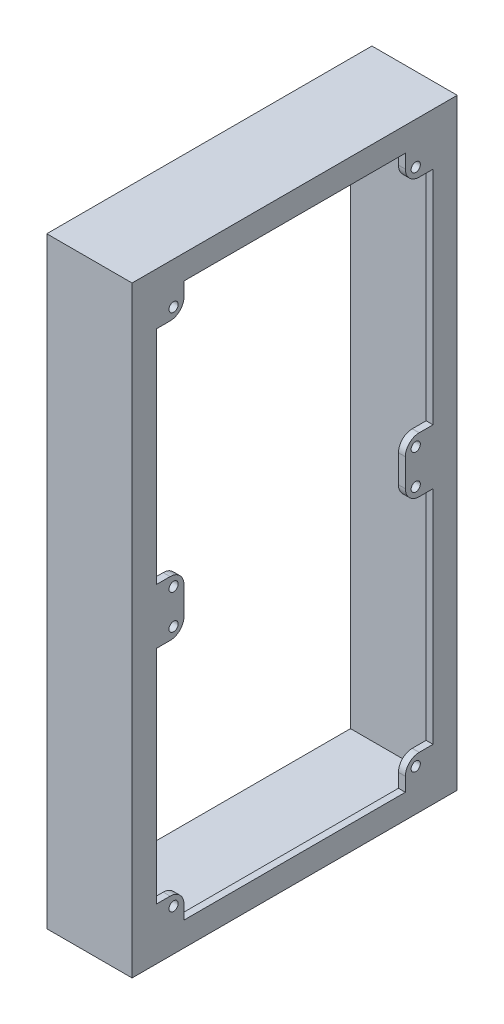
from build123d import *

# Parameters (mm, degrees)
SKETCH1_W                = 261
SKETCH1_H                = 141
SKETCH1_W_2              = 240
SKETCH1_H_2              = 120
SKETCH1_R                = 2
BOSS_EXTRUDE2_DEPTH      = 3
SKETCH1_6_W              = 261
SKETCH1_6_H              = 141
SKETCH1_6_W_2            = 240
SKETCH1_6_H_2            = 120
BOSS_EXTRUDE5_DEPTH      = 34
SKETCH14_W               = 259
SKETCH14_H               = 139
SKETCH14_W_2             = 258.2
SKETCH14_H_2             = 138.2
BOSS_EXTRUDE7_DEPTH      = 0.2
SKETCH17_W               = 259.4
SKETCH17_H               = 139.4
SKETCH17_W_2             = 258.2
SKETCH17_H_2             = 138.2
BOSS_EXTRUDE10_DEPTH     = 0.4
CHAMFER1_SIZE            = 0.4
CHAMFER1_SIZE_2          = 0.230940108
COVER_START              = -0.4
SKETCH18_R               = 3.15
COVER_MAGNET_HOLES_DEPTH = 2.2
SKETCH19_W               = 16
SKETCH19_H               = 240
CUT_EXTRUDE1_DEPTH       = 5
CHAMFER2_SIZE            = 3
CHAMFER2_SIZE_2          = 5.196152423
CHAMFER3_SIZE            = 5
CUT_EXTRUDE2_START       = -10.5
CUT_EXTRUDE2_DEPTH       = 11.5
CUT_EXTRUDE3_REACH       = 154.871
SKETCH21_W               = 242.4
SKETCH21_H               = 122.4


with BuildPart() as part:
    # Sketch1 → Boss-Extrude2 (new body)
    # profile 1 of 9: a face of its own
    with BuildSketch(Plane.YZ):
        Rectangle(SKETCH1_W, SKETCH1_H)
        Rectangle(SKETCH1_W_2, SKETCH1_H_2, mode=Mode.SUBTRACT)
    # profile 2 of 9: a face of its own
    with BuildSketch(Plane.YZ):
        with BuildLine():
            Line((-120, 60), (-120, 48))
            Line((-120, 48), (-114, 48))
            ThreePointArc((-114, 48), (-109.757359313, 49.757359313), (-108, 54))
            Line((-108, 54), (-108, 60))
            Line((-108, 60), (-120, 60))
        make_face()
        with Locations(Location((-112.5, 52.5, 0), (0, 0, 270))):
            Circle(SKETCH1_R, mode=Mode.SUBTRACT)
    # profile 3 of 9: a face of its own
    with BuildSketch(Plane.YZ):
        with BuildLine():
            Line((0, 60), (-12, 60))
            Line((-12, 60), (-12, 54))
            ThreePointArc((-12, 54), (-10.242640687, 49.757359313), (-6, 48))
            Line((-6, 48), (0, 48))
            Line((0, 48), (0, 60))
        make_face()
        with Locations(Location((-7.5, 52.5, 0), (0, 0, 270))):
            Circle(SKETCH1_R, mode=Mode.SUBTRACT)
    # profile 4 of 9: a face of its own
    with BuildSketch(Plane.YZ):
        with BuildLine():
            Line((12, 60), (0, 60))
            Line((0, 60), (0, 48))
            Line((0, 48), (6, 48))
            ThreePointArc((6, 48), (10.242640687, 49.757359313), (12, 54))
            Line((12, 54), (12, 60))
        make_face()
        with Locations(Location((7.5, 52.5, 0), (0, 0, 270))):
            Circle(SKETCH1_R, mode=Mode.SUBTRACT)
    # profile 5 of 9: a face of its own
    with BuildSketch(Plane.YZ):
        with BuildLine():
            Line((114, 48), (120, 48))
            Line((120, 48), (120, 60))
            Line((120, 60), (108, 60))
            Line((108, 60), (108, 54))
            ThreePointArc((108, 54), (109.757359313, 49.757359313), (114, 48))
        make_face()
        with Locations(Location((112.5, 52.5, 0), (0, 0, 270))):
            Circle(SKETCH1_R, mode=Mode.SUBTRACT)
    # profile 6 of 9: a face of its own
    with BuildSketch(Plane.YZ):
        with BuildLine():
            Line((108, -54), (108, -60))
            Line((108, -60), (120, -60))
            Line((120, -60), (120, -48))
            Line((120, -48), (114, -48))
            ThreePointArc((114, -48), (109.757359313, -49.757359313), (108, -54))
        make_face()
        with Locations(Location((112.5, -52.5, 0), (0, 0, 270))):
            Circle(SKETCH1_R, mode=Mode.SUBTRACT)
    # profile 7 of 9: a face of its own
    with BuildSketch(Plane.YZ):
        with BuildLine():
            Line((0, -48), (0, -60))
            Line((0, -60), (12, -60))
            Line((12, -60), (12, -54))
            ThreePointArc((12, -54), (10.242640687, -49.757359313), (6, -48))
            Line((6, -48), (0, -48))
        make_face()
        with Locations(Location((7.5, -52.5, 0), (0, 0, 270))):
            Circle(SKETCH1_R, mode=Mode.SUBTRACT)
    # profile 8 of 9: a face of its own
    with BuildSketch(Plane.YZ):
        with BuildLine():
            Line((-12, -54), (-12, -60))
            Line((-12, -60), (0, -60))
            Line((0, -60), (0, -48))
            Line((0, -48), (-6, -48))
            ThreePointArc((-6, -48), (-10.242640687, -49.757359313), (-12, -54))
        make_face()
        with Locations(Location((-7.5, -52.5, 0), (0, 0, 270))):
            Circle(SKETCH1_R, mode=Mode.SUBTRACT)
    # profile 9 of 9: a face of its own
    with BuildSketch(Plane.YZ):
        with BuildLine():
            Line((-120, -48), (-120, -60))
            Line((-120, -60), (-108, -60))
            Line((-108, -60), (-108, -54))
            ThreePointArc((-108, -54), (-109.757359313, -49.757359313), (-114, -48))
            Line((-114, -48), (-120, -48))
        make_face()
        with Locations(Location((-112.5, -52.5, 0), (0, 0, 270))):
            Circle(SKETCH1_R, mode=Mode.SUBTRACT)
    extrude(amount=BOSS_EXTRUDE2_DEPTH)

    # Sketch1<6> → Boss-Extrude5 (add)
    with BuildSketch(Plane.YZ):
        Rectangle(SKETCH1_6_W, SKETCH1_6_H)
        Rectangle(SKETCH1_6_W_2, SKETCH1_6_H_2, mode=Mode.SUBTRACT)
    extrude(amount=-BOSS_EXTRUDE5_DEPTH)

    # Sketch14 → Boss-Extrude7 (add)
    with BuildSketch(Plane(origin=(-34, 0, 0), x_dir=(0, -1, 0), z_dir=(-1, 0, 0))):
        Rectangle(SKETCH14_W, SKETCH14_H)
        Rectangle(SKETCH14_W_2, SKETCH14_H_2, mode=Mode.SUBTRACT)
    extrude(amount=BOSS_EXTRUDE7_DEPTH)

    # Sketch17 → Boss-Extrude10 (add)
    with BuildSketch(Plane(origin=(-34.2, 0, 0), x_dir=(0, -1, 0), z_dir=(-1, 0, 0))):
        Rectangle(SKETCH17_W, SKETCH17_H)
        Rectangle(SKETCH17_W_2, SKETCH17_H_2, mode=Mode.SUBTRACT)
    extrude(amount=BOSS_EXTRUDE10_DEPTH)

    # Chamfer1
    # the kernel refuses this chamfer: 0.4, 0.230940108 mm, written as the material it takes off along each edge
    with BuildSketch(Plane(origin=(-34.6, 130.734834302, -69.7), x_dir=(1, 0, 0), z_dir=(0, -1, 0))) as chamfer1_piece_1:
        Polygon((CHAMFER1_SIZE, 0), (0, CHAMFER1_SIZE_2 * 0.999999998596), (0, 0), align=None)
    extrude(amount=261.469668604, mode=Mode.SUBTRACT)
    with BuildSketch(Plane(origin=(-34.6, -129.7, -70.734834302), x_dir=(0, 1, 0), z_dir=(0, 0, 1)), Plane(origin=(-34.6, 129.7, 70.734834302), x_dir=(0, -1, 0), z_dir=(0, 0, -1))) as chamfer1_piece_2:
        Polygon((CHAMFER1_SIZE_2 * 0.999999998596, 0), (0, -CHAMFER1_SIZE), (0, 0), align=None)
    extrude(amount=141.469668604, mode=Mode.SUBTRACT)
    with BuildSketch(Plane(origin=(-34.6, -130.734834302, 69.7), x_dir=(0, 0, -1), z_dir=(0, 1, 0))) as chamfer1_piece_3:
        Polygon((CHAMFER1_SIZE_2 * 0.999999998596, 0), (0, -CHAMFER1_SIZE), (0, 0), align=None)
    extrude(amount=261.469668604, mode=Mode.SUBTRACT)

    # Sketch18 → Cover magnet holes (cut)
    with BuildSketch(Plane.YZ.offset(3).offset(COVER_START)):
        with Locations(Location((-125.5, 65.5, 0), (0, 0, 270))):
            Circle(SKETCH18_R)
        with Locations(Location((125.5, 65.5, 0), (0, 0, 90))):
            Circle(SKETCH18_R)
        with Locations(Location((125.5, -65.5, 0), (0, 0, 270))):
            Circle(SKETCH18_R)
        with Locations(Location((-125.5, -65.5, 0), (0, 0, 90))):
            Circle(SKETCH18_R)
    extrude(amount=-COVER_MAGNET_HOLES_DEPTH, mode=Mode.SUBTRACT)

    # Sketch19 → Cut-Extrude1 (cut)
    with BuildSketch(Plane(origin=(0, 0, 60), x_dir=(1, 0, 0), z_dir=(0, 0, -1))):
        with Locations((-21, 0)):
            Rectangle(SKETCH19_W, SKETCH19_H)
    extrude(amount=-CUT_EXTRUDE1_DEPTH, mode=Mode.SUBTRACT)

    # Chamfer2
    # the kernel refuses this chamfer: 5.196152423, 3 mm, written as the material it takes off along each edge
    with BuildSketch(Plane(origin=(-29, 120, 60), x_dir=(-1, 0, 0), z_dir=(0, -1, 0))) as chamfer2_piece_1_section:
        Polygon((CHAMFER2_SIZE, 0), (0, -CHAMFER2_SIZE_2), (0, 0), align=None)
    chamfer2_piece_1 = extrude(amount=240, mode=Mode.PRIVATE)
    chamfer2_piece_1 = split(chamfer2_piece_1, bisect_by=Plane(origin=(-29, 120, 65), z_dir=(0, 0, -1)), keep=Keep.TOP, mode=Mode.PRIVATE)
    add(chamfer2_piece_1, mode=Mode.SUBTRACT)

    # Chamfer3
    chamfer3_edges = [part.edges().sort_by_distance(p)[0] for p in [
        (-13, 0, 60),
    ]]
    chamfer(chamfer3_edges, length=CHAMFER3_SIZE - 0.0001)  # a hair under: the kernel refuses the full size

    # Cut-Extrude2: read off the stored shape, not the designer's step
    # Cut-Extrude2 outline → Cut-Extrude2 (cut)
    with BuildSketch(Plane(origin=(0, -120, 0), x_dir=(-1, 0, 0), z_dir=(0, 1, 0)).offset(CUT_EXTRUDE2_START)):
        Polygon((13, 65), (8, 60), (13, 55), (29.113248654, 55), (32, 60), (29.113248654, 65), align=None)
    extrude(amount=CUT_EXTRUDE2_DEPTH, mode=Mode.SUBTRACT)

    # Cut-Extrude3: up to this face of the body (flat: up to its plane)
    cut_extrude3_end = Plane(part.part.faces().sort_by_distance((0, 114.443379347, 54.443379347))[0])
    # Sketch21 → Cut-Extrude3 (cut, up to the picked face)
    with BuildSketch(Plane(origin=(-34, 0, 0), x_dir=(0, -1, 0), z_dir=(-1, 0, 0)), mode=Mode.PRIVATE) as cut_extrude3_sk1:
        Rectangle(SKETCH21_W, SKETCH21_H)
    cut_extrude3_tool1 = split(extrude(cut_extrude3_sk1.sketch, amount=-CUT_EXTRUDE3_REACH, mode=Mode.PRIVATE), bisect_by=cut_extrude3_end, keep=Keep.BOTH, mode=Mode.PRIVATE)
    add(cut_extrude3_tool1.solids().sort_by(Axis((-34, 0, 0), (1, 0, 0)))[0], mode=Mode.SUBTRACT)


solid = part.part
